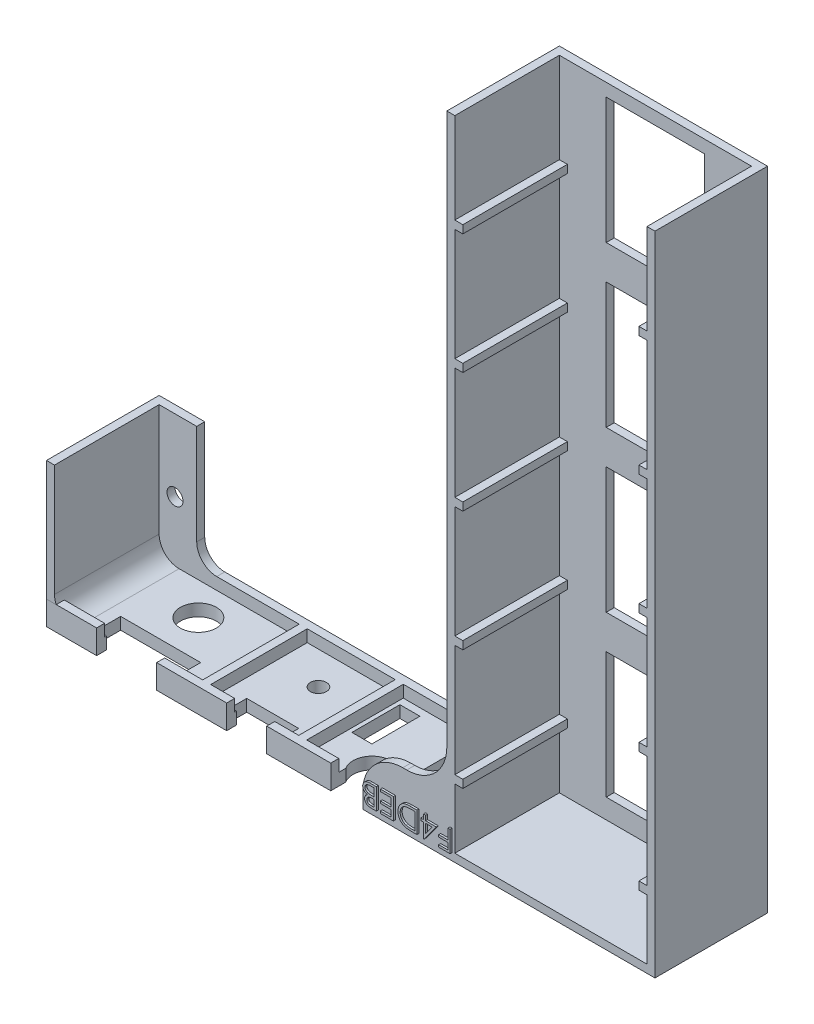
from build123d import *

# Parameters (mm, degrees)
ESQUISSE1_W                = 100
ESQUISSE1_H                = 28.1204521
BOSS_EXTRU_1_DEPTH         = 3
ESQUISSE2_R                = 4.5
ESQUISSE2_R_2              = 2
ESQUISSE2_W                = 5
ESQUISSE2_H                = 12
ENL_V_MAT_EXTRU_7_DEPTH    = 53.025858537
ESQUISSE3_W                = 21
ESQUISSE3_H                = 2
BOSS_EXTRU_2_DEPTH         = 3
BOSS_EXTRU_3_DEPTH         = 30
ESQUISSE5_R                = 2
ENL_V_MAT_EXTRU_8_DEPTH    = 10
CONG_1_R                   = 5
ESQUISSE6_W                = 28.1204521
ESQUISSE6_H                = 2
BOSS_EXTRU_4_DEPTH         = 52
BOSS_EXTRU_5_DEPTH         = 159.6
ESQUISSE8_W                = 26.1204521
ESQUISSE8_H                = 2
BOSS_EXTRU_6_DEPTH         = 2
R_P_TITION_LIN_AIRE1_COUNT = 5
R_P_TITION_LIN_AIRE1_PITCH = 30
SYM_TRIE2_COPY_1_SKETCH_W  = 26.1204521
SYM_TRIE2_COPY_1_SKETCH_H  = 2
SYM_TRIE2_COPY_1_DEPTH     = 2
SYM_TRIE2_COPY_2_SKETCH_W  = 26.1204521
SYM_TRIE2_COPY_2_SKETCH_H  = 2
SYM_TRIE2_COPY_2_DEPTH     = 2
SYM_TRIE2_COPY_3_SKETCH_W  = 26.1204521
SYM_TRIE2_COPY_3_SKETCH_H  = 2
SYM_TRIE2_COPY_3_DEPTH     = 2
SYM_TRIE2_COPY_4_SKETCH_W  = 26.1204521
SYM_TRIE2_COPY_4_SKETCH_H  = 2
SYM_TRIE2_COPY_4_DEPTH     = 2
ESQUISSE11_W               = 24.590809616
ESQUISSE11_H               = 31.467436794
ENL_V_MAT_EXTRU_9_DEPTH    = 193.878284259
R_P_TITION_LIN_AIRE2_COUNT = 4
R_P_TITION_LIN_AIRE2_PITCH = 40
ESQUISSE13_R               = 2
ESQUISSE13_R_2             = 0.6
ENL_V_MAT_EXTRU_10_DEPTH   = 5
ESQUISSE14_W               = 21
ESQUISSE14_H               = 2
BOSS_EXTRU_7_DEPTH         = 8
CONG_2_R                   = 10
BOSS_EXTRU_8_DEPTH         = 0.5


with BuildPart() as part:
    # Esquisse1 → Boss.-Extru.1 (new body)
    with BuildSketch(Plane(origin=(0, 0, 0), x_dir=(1, 0, 0), z_dir=(0, 1, 0))):
        Rectangle(ESQUISSE1_W, ESQUISSE1_H)
    extrude(amount=BOSS_EXTRU_1_DEPTH)

    # Esquisse2 → Enlèv. mat.-Extru.7 (cut, through all)
    with BuildSketch(Plane(origin=(0, 3, 0), x_dir=(1, 0, 0), z_dir=(0, 1, 0))):
        with Locations(Location((-30, 3.867114947, 0), (0, 0, 270))):
            Circle(ESQUISSE2_R)
        Polygon((-37.5, -14.06022605), (-22.5, -14.06022605), (-22.5, -11.56022605), (-20, -11.56022605), (-20, -5.56022605), (-40, -5.56022605), (-40, -11.56022605), (-37.5, -11.56022605), align=None)
        Polygon((-5, -11.56022605), (-5, -14.06022605), (5, -14.06022605), (5, -11.56022605), (6.5, -11.56022605), (6.5, -7.56022605), (-6.5, -7.56022605), (-6.5, -11.56022605), align=None)
        with Locations(Location((0, 3.867114947, 0), (0, 0, 270))):
            Circle(ESQUISSE2_R_2)
        with Locations((16.5, 4.220364722)):
            Rectangle(ESQUISSE2_W, ESQUISSE2_H)
        with BuildLine():
            Line((21, -10.313075065), (21, -14.06022605))
            Line((21, -14.06022605), (29, -14.06022605))
            Line((29, -14.06022605), (29, -10.313075065))
            ThreePointArc((29, -10.313075065), (25, -3.001337373), (21, -10.313075065))
        make_face()
        with Locations((33.5, 4.220364722)):
            Rectangle(ESQUISSE2_W, ESQUISSE2_H)
    extrude(amount=-ENL_V_MAT_EXTRU_7_DEPTH, mode=Mode.SUBTRACT)

    # Esquisse3 → Boss.-Extru.2 (add)
    with BuildSketch(Plane(origin=(0, 3, 0), x_dir=(1, 0, 0), z_dir=(0, 1, 0))):
        Polygon((-50, 14.06022605), (50, 14.06022605), (50, 12.06022605), (13, 12.06022605), (13, -12.06022605), (21, -12.06022605), (21, -14.06022605), (5, -14.06022605), (5, -12.06022605), (11, -12.06022605), (11, 12.06022605), (-11, 12.06022605), (-11, -12.06022605), (-5, -12.06022605), (-5, -14.06022605), (-22.5, -14.06022605), (-22.5, -12.06022605), (-13, -12.06022605), (-13, 12.06022605), (-48, 12.06022605), (-48, -12.06022605), (-37.5, -12.06022605), (-37.5, -14.06022605), (-50, -14.06022605), align=None)
        with Locations((39.5, -13.06022605)):
            Rectangle(ESQUISSE3_W, ESQUISSE3_H)
    extrude(amount=BOSS_EXTRU_2_DEPTH)

    # Esquisse4 → Boss.-Extru.3 (add)
    with BuildSketch(Plane(origin=(0, 6, 0), x_dir=(1, 0, 0), z_dir=(0, 1, 0))):
        Polygon((-48, 12.06022605), (-48, -14.083081675), (-50, -14.083081675), (-50, 14.06022605), (-38.60677801, 14.06022605), (-38.60677801, 12.06022605), align=None)
    extrude(amount=BOSS_EXTRU_3_DEPTH)

    # Esquisse5 → Enlèv. mat.-Extru.8 (cut)
    with BuildSketch(Plane(origin=(0, 0, -14.06022605), x_dir=(-1, 0, 0), z_dir=(0, 0, -1))):
        with Locations((44.029853577, 18.06052302)):
            Circle(ESQUISSE5_R)
    extrude(amount=-ENL_V_MAT_EXTRU_8_DEPTH, mode=Mode.SUBTRACT)

    # Congé1
    # the kernel refuses this fillet: 5 mm, written as the material it adds along each edge
    with BuildSketch(Plane(origin=(-48, 3, -12.06022605), x_dir=(0, 1, 0), z_dir=(0, 0, 1))) as cong_1_piece_1_section:
        with BuildLine():
            CenterArc((CONG_1_R, -CONG_1_R), CONG_1_R, 90, 90)
            Line((0, -CONG_1_R), (0, 0))
            Line((0, 0), (CONG_1_R, 0))
        make_face()
    cong_1_piece_1 = extrude(amount=36.620452099, mode=Mode.PRIVATE)
    cong_1_piece_1 = split(cong_1_piece_1, bisect_by=Plane(origin=(-47.875722778, 6.495730314, 14.083081675), z_dir=(0, 0, -1)), keep=Keep.TOP, mode=Mode.PRIVATE)
    cong_1_piece_1 = split(cong_1_piece_1, bisect_by=Plane(origin=(-47.875722778, 6, 0), z_dir=(0, 1, 0)), keep=Keep.TOP, mode=Mode.PRIVATE)
    add(cong_1_piece_1)
    with BuildSketch(Plane(origin=(-48, 3, -12.06022605), x_dir=(0, 1, 0), z_dir=(0, 0, 1))) as cong_1_piece_2:
        with BuildLine():
            CenterArc((CONG_1_R, -CONG_1_R), CONG_1_R, 90, 90)
            Line((0, -CONG_1_R), (0, 0))
            Line((0, 0), (CONG_1_R, 0))
        make_face()
    extrude(amount=24.120452099)
    with BuildSketch(Plane(origin=(-38.60677801, 6, -14.06022605), x_dir=(0, 1, 0), z_dir=(0, 0, 1))) as cong_1_piece_3:
        with BuildLine():
            CenterArc((CONG_1_R, -CONG_1_R), CONG_1_R, 90, 90)
            Line((0, -CONG_1_R), (0, 0))
            Line((0, 0), (CONG_1_R, 0))
        make_face()
    extrude(amount=2)

    # Esquisse6 → Boss.-Extru.4 (add)
    with BuildSketch(Plane(origin=(50, 0, 0), x_dir=(0, 0, -1), z_dir=(1, 0, 0))):
        with Locations((0, 1)):
            Rectangle(ESQUISSE6_W, ESQUISSE6_H)
    extrude(amount=BOSS_EXTRU_4_DEPTH)

    # Esquisse7 → Boss.-Extru.5 (add)
    with BuildSketch(Plane(origin=(0, 2, 0), x_dir=(1, 0, 0), z_dir=(0, 1, 0))):
        Polygon((50, 14.06022605), (50, -14.06022605), (52, -14.06022605), (52, 12.06022605), (100, 12.06022605), (100, -14.06022605), (102, -14.06022605), (102, 14.06022605), align=None)
    extrude(amount=BOSS_EXTRU_5_DEPTH)

    # Esquisse8 → Boss.-Extru.6 (add)
    with BuildSketch(Plane(origin=(52, 0, 0), x_dir=(0, 0, -1), z_dir=(1, 0, 0))):
        with Locations((-1, 18)):
            Rectangle(ESQUISSE8_W, ESQUISSE8_H)
    boss_extru_6 = extrude(amount=BOSS_EXTRU_6_DEPTH)

    # Répétition linéaire1: Boss.-Extru.6 ×5
    with Locations(*[(0, i * R_P_TITION_LIN_AIRE1_PITCH, 0) for i in range(1, R_P_TITION_LIN_AIRE1_COUNT)]):
        add(boss_extru_6)

    # Symétrie2: Boss.-Extru.6 across plane
    add(boss_extru_6.mirror(Plane(origin=(76, 0, 0), x_dir=(0, 0, 1), z_dir=(1, 0, 0))))

    # Symétrie2 copy 1 sketch → Symétrie2 copy 1 (add)
    with BuildSketch(Plane(origin=(100, 30, 0), x_dir=(0, 0, -1), z_dir=(-1, 0, 0))):
        with Locations((-1, -18)):
            Rectangle(SYM_TRIE2_COPY_1_SKETCH_W, SYM_TRIE2_COPY_1_SKETCH_H)
    extrude(amount=SYM_TRIE2_COPY_1_DEPTH)

    # Symétrie2 copy 2 sketch → Symétrie2 copy 2 (add)
    with BuildSketch(Plane(origin=(100, 60, 0), x_dir=(0, 0, -1), z_dir=(-1, 0, 0))):
        with Locations((-1, -18)):
            Rectangle(SYM_TRIE2_COPY_2_SKETCH_W, SYM_TRIE2_COPY_2_SKETCH_H)
    extrude(amount=SYM_TRIE2_COPY_2_DEPTH)

    # Symétrie2 copy 3 sketch → Symétrie2 copy 3 (add)
    with BuildSketch(Plane(origin=(100, 90, 0), x_dir=(0, 0, -1), z_dir=(-1, 0, 0))):
        with Locations((-1, -18)):
            Rectangle(SYM_TRIE2_COPY_3_SKETCH_W, SYM_TRIE2_COPY_3_SKETCH_H)
    extrude(amount=SYM_TRIE2_COPY_3_DEPTH)

    # Symétrie2 copy 4 sketch → Symétrie2 copy 4 (add)
    with BuildSketch(Plane(origin=(100, 120, 0), x_dir=(0, 0, -1), z_dir=(-1, 0, 0))):
        with Locations((-1, -18)):
            Rectangle(SYM_TRIE2_COPY_4_SKETCH_W, SYM_TRIE2_COPY_4_SKETCH_H)
    extrude(amount=SYM_TRIE2_COPY_4_DEPTH)

    # Esquisse11 → Enlèv. mat.-Extru.9 (cut, through all)
    with BuildSketch(Plane.XY.offset(-12.06022605)):
        with Locations((76, 22.659143711)):
            Rectangle(ESQUISSE11_W, ESQUISSE11_H)
    enl_v_mat_extru_9 = extrude(amount=-ENL_V_MAT_EXTRU_9_DEPTH, mode=Mode.SUBTRACT)

    # Répétition linéaire2: Enlèv. mat.-Extru.9 ×4
    with Locations(*[(0, i * R_P_TITION_LIN_AIRE2_PITCH, 0) for i in range(1, R_P_TITION_LIN_AIRE2_COUNT)]):
        add(enl_v_mat_extru_9, mode=Mode.SUBTRACT)

    # Esquisse13 → Enlèv. mat.-Extru.10 (cut)
    with BuildSketch(Plane.XZ):
        with Locations(Location((37.133590925, 9.539048239, 0), (0, 0, 270))):
            Circle(ESQUISSE13_R)
        with Locations(Location((45.165188622, 9.539048239, 0), (0, 0, 270))):
            Circle(ESQUISSE13_R_2)
    extrude(amount=-ENL_V_MAT_EXTRU_10_DEPTH, mode=Mode.SUBTRACT)

    # Esquisse14 → Boss.-Extru.7 (add)
    with BuildSketch(Plane(origin=(0, 6, 0), x_dir=(1, 0, 0), z_dir=(0, 1, 0))):
        with Locations((39.5, -13.06022605)):
            Rectangle(ESQUISSE14_W, ESQUISSE14_H)
    extrude(amount=BOSS_EXTRU_7_DEPTH)

    # Congé2
    cong_2_edges = [part.edges().sort_by_distance(p)[0] for p in [
        (29, 14, 13.06022605),
        (50, 14, 13.06022605),
    ]]
    fillet(cong_2_edges, radius=CONG_2_R)

    # Esquisse15 → Boss.-Extru.8 (add)
    # profile 1 of 5: a face of its own
    with BuildSketch(Plane.XY.offset(14.06022605)):
        Polygon((51.321581197, 1.794804475), (48.472222222, 1.794804475), (48.472222222, 2.337539518), (50.778846154, 2.337539518), (50.778846154, 3.965744646), (48.472222222, 3.965744646), (48.472222222, 4.508479689), (50.778846154, 4.508479689), (50.778846154, 7.086471142), (51.321581197, 7.086471142), align=None)
    # profile 2 of 5: a face of its own
    with BuildSketch(Plane.XY.offset(14.06022605)):
        Polygon((44.783319979, 1.659120714), (44.673076923, 1.659120714), (44.673076923, 5.322582253), (43.99465812, 5.322582253), (43.99465812, 5.865317296), (44.673076923, 5.865317296), (44.673076923, 7.086471142), (45.215811966, 7.086471142), (45.215811966, 5.865317296), (47.861645299, 5.865317296), align=None)
        Polygon((45.215811966, 5.322582253), (45.215811966, 3.143161847), (46.810096154, 5.322582253), align=None, mode=Mode.SUBTRACT)
    # profile 3 of 5: a face of its own
    with BuildSketch(Plane.XY.offset(14.06022605)):
        with BuildLine():
            Line((43.044871795, 7.086471142), (43.044871795, 1.794804475))
            Line((43.044871795, 1.794804475), (41.875659388, 1.794804475))
            add(Edge.make_bspline(
                [(41.875659388, 1.794804475), (41.773890851, 1.795470747), (41.577383994, 1.796757264), (41.293553519, 1.804979663), (41.031580146, 1.819354154), (40.79124781, 1.840795783), (40.572206743, 1.866368494), (40.374774491, 1.898988674), (40.199004804, 1.937283062), (40.090749022, 1.970121163), (40.039688502, 1.985609764)],
                knots=[0, 0, 0, 0, 1.318494493, 2.545906798, 3.678452465, 4.717091566, 5.671594071, 6.534820697, 7.30892544, 8, 8, 8, 8], degree=3))
            add(Edge.make_bspline(
                [(40.039688502, 1.985609764), (39.972853479, 2.008948954), (39.84075168, 2.055079696), (39.651921424, 2.141588404), (39.474090433, 2.240100392), (39.308246476, 2.352109251), (39.153049969, 2.47545977), (39.007696974, 2.610236067), (38.875530978, 2.759264341), (38.754503351, 2.919376018), (38.64666806, 3.089540087), (38.5530292, 3.268710269), (38.473271595, 3.455386844), (38.408687668, 3.650529963), (38.357477122, 3.853453609), (38.321848803, 4.064712897), (38.300325038, 4.283658148), (38.297415981, 4.432108479), (38.295940171, 4.507419659)],
                knots=[0, 0, 0, 0, 1.03101212, 2.037832141, 3.021926849, 3.990041471, 4.950059404, 5.908045932, 6.874297054, 7.848361802, 8.829583904, 9.805972403, 10.790915149, 11.784018267, 12.797921268, 13.83728035, 14.902818406, 16, 16, 16, 16], degree=3))
            add(Edge.make_bspline(
                [(38.295940171, 4.507419659), (38.2967368, 4.572834705), (38.298307407, 4.701804823), (38.317372674, 4.891861148), (38.345936849, 5.075886754), (38.384326404, 5.254454843), (38.437251947, 5.426510156), (38.499268239, 5.593349904), (38.573727987, 5.753880107), (38.659735685, 5.907268896), (38.754540978, 6.052652907), (38.856719293, 6.188821289), (38.964983615, 6.315660856), (39.080828234, 6.432598836), (39.203591245, 6.539376173), (39.33274177, 6.636650118), (39.46855317, 6.723958491), (39.613408877, 6.800702092), (39.768173154, 6.869470823), (39.937149063, 6.927462011), (40.120210462, 6.977091348), (40.31826537, 7.016794539), (40.530482315, 7.048784572), (40.757686019, 7.070154172), (40.999535215, 7.084546287), (41.165770375, 7.085817219), (41.251302083, 7.086471142)],
                knots=[0, 0, 0, 0, 1.054858778, 2.079724305, 3.077736718, 4.0582614, 5.022952888, 5.978933092, 6.927595642, 7.874286971, 8.813363436, 9.725340709, 10.618692304, 11.501360905, 12.378046495, 13.241005743, 14.107459147, 14.979537415, 15.882942425, 16.836523721, 17.858341504, 18.940414164, 20.093139098, 21.318767614, 22.620445962, 24, 24, 24, 24], degree=3))
            Line((41.251302083, 7.086471142), (43.044871795, 7.086471142))
        make_face()
        with BuildLine():
            Line((42.502136752, 6.543736099), (41.845978566, 6.543736099))
            add(Edge.make_bspline(
                [(41.845978566, 6.543736099), (41.751632291, 6.543360301), (41.570336822, 6.542638168), (41.309871076, 6.536333163), (41.071658602, 6.525896136), (40.856003262, 6.511559382), (40.663024744, 6.492401843), (40.4924182, 6.47082345), (40.34421607, 6.444470931), (40.254038793, 6.42026817), (40.212473291, 6.409112368)],
                knots=[0, 0, 0, 0, 1.377932993, 2.64783117, 3.804968788, 4.860218214, 5.80403942, 6.636825548, 7.371670635, 8, 8, 8, 8], degree=3))
            add(Edge.make_bspline(
                [(40.212473291, 6.409112368), (40.160287068, 6.392138733), (40.057479271, 6.358700366), (39.909289406, 6.297156381), (39.770688572, 6.224875025), (39.639891939, 6.143874844), (39.518032201, 6.052552597), (39.404527344, 5.951894954), (39.299657513, 5.84153154), (39.203833972, 5.722493495), (39.117437835, 5.595153525), (39.043364818, 5.459625004), (38.979181506, 5.317850399), (38.928928843, 5.168406669), (38.887913902, 5.013066777), (38.860167287, 4.850222917), (38.840995044, 4.68066222), (38.839456606, 4.565070276), (38.838675214, 4.50635963)],
                knots=[0, 0, 0, 0, 1.03991216, 2.048645673, 3.037166538, 3.999824964, 4.961574353, 5.919889621, 6.872077056, 7.843779081, 8.813424739, 9.784641947, 10.767953509, 11.759170581, 12.76957023, 13.810107642, 14.887725291, 16, 16, 16, 16], degree=3))
            add(Edge.make_bspline(
                [(38.838675214, 4.50635963), (38.839981342, 4.444487872), (38.842547017, 4.322950962), (38.860242324, 4.144173568), (38.892583572, 3.972823521), (38.936123626, 3.808091034), (38.990522936, 3.649302168), (39.060559327, 3.498569818), (39.140684843, 3.353651561), (39.234440144, 3.217315144), (39.337895753, 3.08864781), (39.45284252, 2.970807367), (39.577675848, 2.863503412), (39.711036505, 2.765322992), (39.855446193, 2.679784401), (40.008266342, 2.602600964), (40.172219098, 2.538202273), (40.286069836, 2.503550205), (40.343916934, 2.485943631)],
                knots=[0, 0, 0, 0, 1.089998388, 2.141122879, 3.160582858, 4.158627459, 5.140999449, 6.113141423, 7.082948792, 8.055011043, 9.024278859, 9.98833552, 10.950481064, 11.921645981, 12.901668197, 13.903858501, 14.93495903, 16, 16, 16, 16], degree=3))
            add(Edge.make_bspline(
                [(40.343916934, 2.485943631), (40.391834851, 2.473659889), (40.494021037, 2.447464496), (40.660349212, 2.419186651), (40.847738002, 2.39394574), (41.05666341, 2.372798936), (41.287194853, 2.357479547), (41.539185989, 2.346079423), (41.812716447, 2.338341295), (42.002150533, 2.337813314), (42.100385617, 2.337539518)],
                knots=[0, 0, 0, 0, 0.671630374, 1.43226897, 2.289500064, 3.239801583, 4.283712342, 5.427140445, 6.66578882, 8, 8, 8, 8], degree=3))
            Line((42.100385617, 2.337539518), (42.502136752, 2.337539518))
            Line((42.502136752, 2.337539518), (42.502136752, 6.543736099))
        make_face(mode=Mode.SUBTRACT)
    # profile 4 of 5: a face of its own
    with BuildSketch(Plane.XY.offset(14.06022605)):
        Polygon((37.142628205, 1.794804475), (33.886217949, 1.794804475), (33.886217949, 2.337539518), (36.599893162, 2.337539518), (36.599893162, 3.965744646), (33.886217949, 3.965744646), (33.886217949, 4.508479689), (36.599893162, 4.508479689), (36.599893162, 6.543736099), (33.886217949, 6.543736099), (33.886217949, 7.086471142), (37.142628205, 7.086471142), align=None)
    # profile 5 of 5: a face of its own
    with BuildSketch(Plane.XY.offset(14.06022605)):
        with BuildLine():
            Line((32.868589744, 1.794804475), (31.758738982, 1.794804475))
            add(Edge.make_bspline(
                [(31.758738982, 1.794804475), (31.704665681, 1.795079535), (31.599291142, 1.795615554), (31.446246384, 1.803546144), (31.302568067, 1.81437083), (31.16910418, 1.832174602), (31.044518906, 1.850970364), (30.930359716, 1.877828049), (30.825591585, 1.908621394), (30.699822475, 1.954178373), (30.55728993, 2.026055371), (30.404638541, 2.133798001), (30.26962471, 2.260323259), (30.156600209, 2.407252684), (30.065485151, 2.567864461), (29.998823493, 2.739418023), (29.958311595, 2.9200833), (29.953711404, 3.043666788), (29.951388889, 3.106060819)],
                knots=[0, 0, 0, 0, 1.026254929, 1.999898973, 2.90834142, 3.760206528, 4.555202422, 5.298709309, 5.984167461, 6.627093254, 7.835875589, 9.000728769, 10.163127162, 11.334315665, 12.50563859, 13.656505565, 14.816831721, 16, 16, 16, 16], degree=3))
            add(Edge.make_bspline(
                [(29.951388889, 3.106060819), (29.953245502, 3.164530231), (29.956899521, 3.279604465), (29.991239962, 3.447489687), (30.045415256, 3.607439011), (30.122205882, 3.758373331), (30.219956317, 3.898884059), (30.338763117, 4.025943504), (30.478237268, 4.138659289), (30.582657699, 4.200249939), (30.636167869, 4.23181202)],
                knots=[0, 0, 0, 0, 1.010708515, 1.989185531, 2.952103278, 3.925562331, 4.909335762, 5.904331522, 6.926076308, 8, 8, 8, 8], degree=3))
            add(Edge.make_bspline(
                [(30.636167869, 4.23181202), (30.567946265, 4.254819485), (30.437932083, 4.298666251), (30.258069324, 4.377196087), (30.102574032, 4.461285088), (29.969840122, 4.552590385), (29.858074498, 4.653628313), (29.759126812, 4.761817131), (29.676086634, 4.881888359), (29.602734688, 5.00856658), (29.547098809, 5.144639225), (29.506636438, 5.286452325), (29.481449202, 5.43370246), (29.478159743, 5.533782633), (29.476495726, 5.58440951)],
                knots=[0, 0, 0, 0, 1.346535245, 2.566176518, 3.666756861, 4.649728586, 5.572052947, 6.480123116, 7.386193792, 8.298010182, 9.213867684, 10.128292516, 11.053172059, 12, 12, 12, 12], degree=3))
            add(Edge.make_bspline(
                [(29.476495726, 5.58440951), (29.47779118, 5.636089664), (29.480342652, 5.737876709), (29.504454003, 5.887226089), (29.543511563, 6.030295551), (29.599504408, 6.166865015), (29.669699258, 6.297666785), (29.754936859, 6.423063971), (29.858043535, 6.540400381), (29.973936103, 6.652647337), (30.10325519, 6.755292046), (30.245536974, 6.84296141), (30.396927229, 6.919327349), (30.559822064, 6.980396535), (30.733324495, 7.028249097), (30.917498717, 7.061321653), (31.111925894, 7.08366045), (31.245265427, 7.085519453), (31.313526643, 7.086471142)],
                knots=[0, 0, 0, 0, 0.934008711, 1.839584044, 2.727883158, 3.61071846, 4.5026873, 5.40837535, 6.346136166, 7.322277462, 8.323242846, 9.325023748, 10.339502205, 11.385059886, 12.465590147, 13.589808968, 14.766138107, 16, 16, 16, 16], degree=3))
            Line((31.313526643, 7.086471142), (32.868589744, 7.086471142))
            Line((32.868589744, 7.086471142), (32.868589744, 1.794804475))
        make_face()
        with BuildLine():
            Line((32.325854701, 2.337539518), (32.325854701, 4.033586526))
            Line((32.325854701, 4.033586526), (31.995125534, 4.033586526))
            add(Edge.make_bspline(
                [(31.995125534, 4.033586526), (31.946364987, 4.032982528), (31.852359937, 4.031818085), (31.716556817, 4.028482096), (31.590816699, 4.019111164), (31.474690371, 4.009590554), (31.368586483, 3.994690794), (31.272897739, 3.976318895), (31.186436735, 3.957161498), (31.086509677, 3.924643393), (30.973390736, 3.877018182), (30.853658972, 3.801212958), (30.746711719, 3.712965348), (30.657562517, 3.609106062), (30.584893395, 3.495770905), (30.532307797, 3.374947351), (30.500162045, 3.247286118), (30.496157655, 3.159954492), (30.494123932, 3.115601083)],
                knots=[0, 0, 0, 0, 1.179360404, 2.273678991, 3.284326392, 4.228173755, 5.091026659, 5.873693526, 6.584641218, 7.230524382, 8.413161738, 9.541774328, 10.645725894, 11.754264971, 12.837618803, 13.890100718, 14.92843831, 16, 16, 16, 16], degree=3))
            add(Edge.make_bspline(
                [(30.494123932, 3.115601083), (30.494921028, 3.08622882), (30.496484621, 3.02861192), (30.509308649, 2.94422896), (30.531283705, 2.864780037), (30.56287222, 2.790855022), (30.600987302, 2.720925427), (30.648980462, 2.655896289), (30.706715045, 2.596881384), (30.772059582, 2.54205991), (30.846593289, 2.492630359), (30.932736799, 2.4520305), (31.028116538, 2.415354951), (31.134702139, 2.388013281), (31.25021856, 2.36400335), (31.376444331, 2.348842216), (31.512657787, 2.33919536), (31.607136267, 2.338103337), (31.655916132, 2.337539518)],
                knots=[0, 0, 0, 0, 0.890403694, 1.746624078, 2.581181674, 3.383185914, 4.179370903, 4.991617541, 5.825211525, 6.677197327, 7.574729245, 8.528392651, 9.559293233, 10.66919549, 11.860717782, 13.135300381, 14.520936583, 16, 16, 16, 16], degree=3))
            Line((31.655916132, 2.337539518), (32.325854701, 2.337539518))
        make_face(mode=Mode.SUBTRACT)
        with BuildLine():
            Line((32.325854701, 4.576321569), (32.325854701, 6.543736099))
            Line((32.325854701, 6.543736099), (31.607154781, 6.543736099))
            add(Edge.make_bspline(
                [(31.607154781, 6.543736099), (31.555922989, 6.543100648), (31.456976239, 6.541873366), (31.313706059, 6.53894307), (31.181292931, 6.528194334), (31.059100781, 6.51785707), (30.947957708, 6.500984814), (30.846594775, 6.484521568), (30.756739478, 6.460375553), (30.651393866, 6.427615727), (30.533817011, 6.374540312), (30.405361343, 6.297333635), (30.293547956, 6.20135201), (30.196465524, 6.093292782), (30.117732987, 5.974895269), (30.060313989, 5.84955546), (30.026450582, 5.71832187), (30.0216412, 5.629117934), (30.019230769, 5.58440951)],
                knots=[0, 0, 0, 0, 1.180210222, 2.279404307, 3.299363644, 4.23957528, 5.102804877, 5.888254215, 6.602831298, 7.243717508, 8.42787779, 9.564080919, 10.68431512, 11.808297662, 12.900812778, 13.946172375, 14.970635151, 16, 16, 16, 16], degree=3))
            add(Edge.make_bspline(
                [(30.019230769, 5.58440951), (30.020137577, 5.556461481), (30.021936066, 5.501031614), (30.033499326, 5.419203251), (30.054129206, 5.340187979), (30.08159317, 5.263800731), (30.116633384, 5.190004238), (30.160731593, 5.119530542), (30.213061513, 5.051845356), (30.292446359, 4.963502272), (30.410440471, 4.863944683), (30.576503227, 4.767904806), (30.764543775, 4.689217652), (30.900589144, 4.656058428), (30.971137153, 4.638863303)],
                knots=[0, 0, 0, 0, 0.690579729, 1.369640178, 2.036639812, 2.70495227, 3.372694251, 4.051024739, 4.754724141, 5.484111883, 6.98313807, 8.544794089, 10.208260244, 12, 12, 12, 12], degree=3))
            add(Edge.make_bspline(
                [(30.971137153, 4.638863303), (30.997946092, 4.633644623), (31.055909612, 4.622361332), (31.150449153, 4.610308436), (31.258615914, 4.599687962), (31.380616958, 4.591849494), (31.515903271, 4.58372151), (31.665096452, 4.580485493), (31.827622667, 4.576746726), (31.940707657, 4.576466779), (31.999365652, 4.576321569)],
                knots=[0, 0, 0, 0, 0.635299181, 1.373578294, 2.21612843, 3.163814608, 4.217659813, 5.369052913, 6.635308885, 8, 8, 8, 8], degree=3))
            Line((31.999365652, 4.576321569), (32.325854701, 4.576321569))
        make_face(mode=Mode.SUBTRACT)
    extrude(amount=BOSS_EXTRU_8_DEPTH)


solid = part.part
